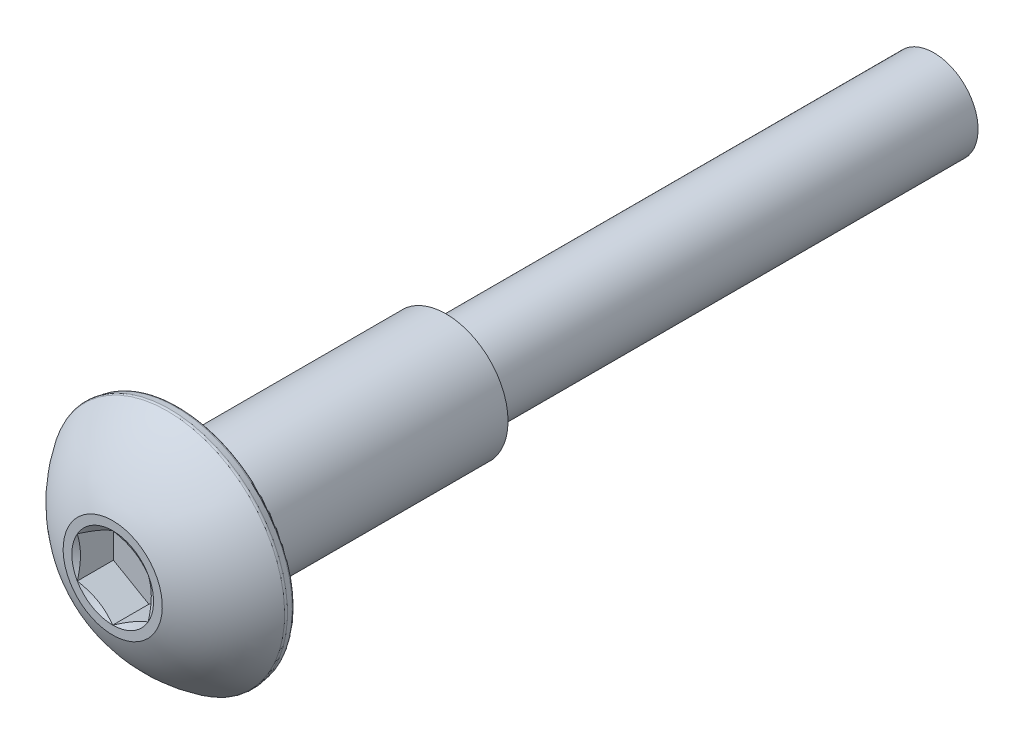
from build123d import *

# Parameters (mm, degrees)
CUT_EXTRUDE1_DEPTH = 1.21539
FILLET1_R          = 0.11049
SKETCH10_R         = 3.811240777
SKETCH10_R_2       = 1.4874875
CUT_EXTRUDE4_DEPTH = 16.4


# Read off the part's stored shape, not the designer's step: Split1
with BuildPart() as part:
    # Sketch3 → Revolve1 (revolve)
    with BuildSketch(Plane(origin=(0, 0, 0), x_dir=(0, 0, -1), z_dir=(1, 0, 0)), mode=Mode.PRIVATE) as revolve1_sk:
        with BuildLine():
            Line((-13.8049, 0), (-13.8049, 1.666875))
            ThreePointArc((-13.8049, 1.666875), (-13.052170588, 2.967189774), (-11.92657, 3.9624))
            Line((-11.92657, 3.9624), (-11.5951, 3.903952896))
            Line((-11.5951, 3.903952896), (-11.5951, 2.0828))
            Line((-11.5951, 2.0828), (13.2095875, 2.0828))
            Line((13.2095875, 2.0828), (13.8049, 1.4874875))
            Line((13.8049, 1.4874875), (13.8049, 0))
            Line((13.8049, 0), (-13.8049, 0))
        make_face()
    revolve(revolve1_sk.sketch.rotate(Axis((0, 0, 13.8049), (0, 0, -1)), 90), axis=Axis((0, 0, 13.8049), (0, 0, -1)))

    # Sketch4 → Cut-Extrude1 (cut)
    with BuildSketch(Plane.XY.offset(13.8049)):
        Polygon((-1.190625, -0.687407664), (0, -1.374815329), (1.190625, -0.687407664), (1.190625, 0.687407664), (0, 1.374815329), (-1.190625, 0.687407664), align=None)
    extrude(amount=-CUT_EXTRUDE1_DEPTH, mode=Mode.SUBTRACT)

    # Cut-Extrude2 cone 1 section (through the dimple's axis) → Cut-Extrude2 (revolve, cut)
    with BuildSketch(Plane(origin=(0, 0, 13.8049), x_dir=(0, -1, 0), z_dir=(1, 0, 0))):
        Polygon((0, 0), (1.374815329, 0), (0, 0.79375), align=None)
    revolve(axis=Axis((0, 0, 13.8049), (0, 0, -1)), mode=Mode.SUBTRACT)

    # Fillet1
    fillet1_edges = [part.edges().sort_by_distance(p)[0] for p in [
        (-3.903952896, 0, 11.5951),
        (-3.9624, 0, 11.92657),
    ]]
    fillet(fillet1_edges, radius=FILLET1_R)


with BuildPart() as body_2:
    # Split1: the piece on the far side of the plane
    add(part.part)
    split(bisect_by=Plane.XY.offset(11.5951), keep=Keep.BOTTOM)


with BuildPart() as part_1:
    add(part.part)

    # Split1
    split(bisect_by=Plane.XY.offset(11.5951), keep=Keep.TOP)

    add(body_2.part)  # Boss-Extrude1 merges body 2
    # Boss-Extrude1 cone 1 section (through the dimple's axis) → Boss-Extrude1 (revolve)
    with BuildSketch(Plane(origin=(0, 0, 11.5951), x_dir=(0, -1, 0), z_dir=(1, 0, 0))):
        Polygon((0, 0), (2.168725958, 0), (0, 2.168725958), align=None)
    revolve(axis=Axis((0, 0, 11.5951), (0, 0, -1)))

    # Sketch10 → Cut-Extrude4 (cut)
    with BuildSketch(Plane(origin=(0, 0, -13.8049), x_dir=(-1, 0, 0), z_dir=(0, 0, -1))):
        Circle(SKETCH10_R)
        Circle(SKETCH10_R_2, mode=Mode.SUBTRACT)
    extrude(amount=-CUT_EXTRUDE4_DEPTH, mode=Mode.SUBTRACT)


solid = part_1.part
